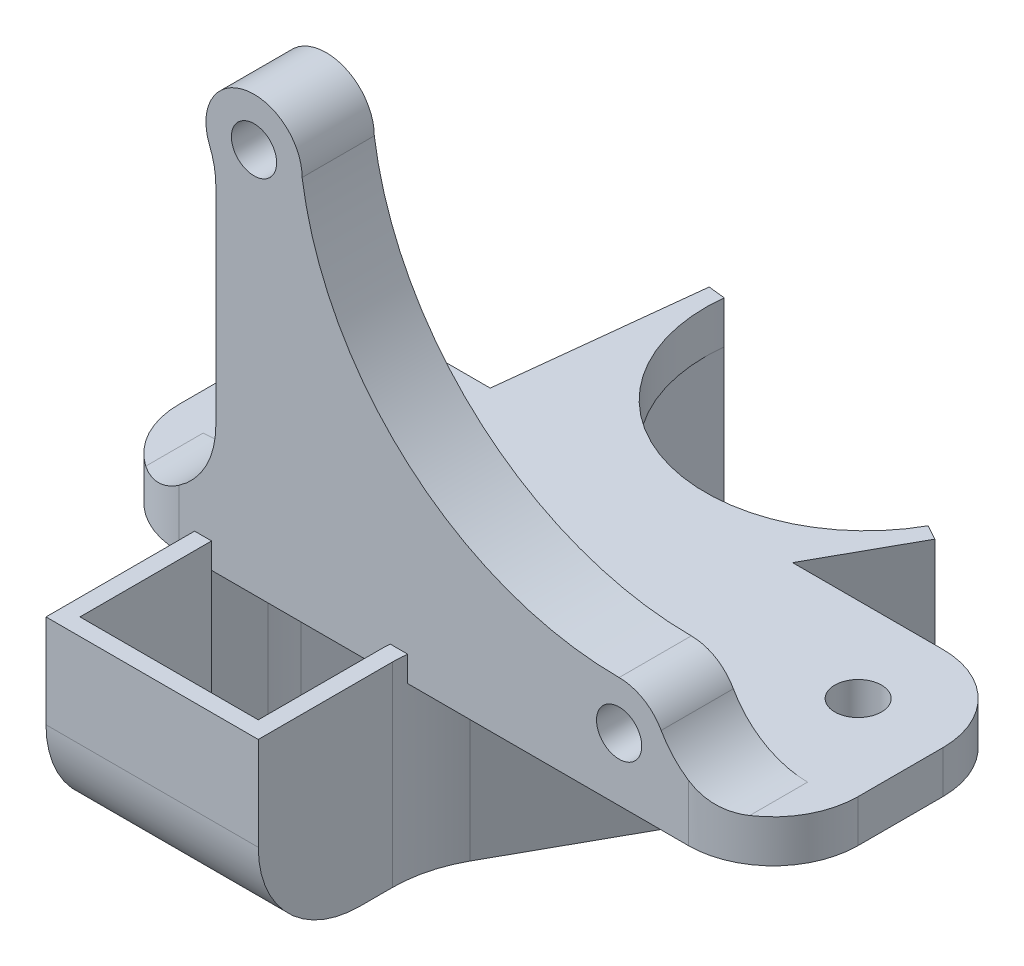
from build123d import *

# Parameters (mm, degrees)
SKETCH1_W           = 80
SKETCH1_H           = 30
SKETCH1_R           = 2.75
BOSS_EXTRUDE1_DEPTH = 5
SKETCH2_W           = 51.3
SKETCH2_H           = 8.5
BOSS_EXTRUDE2_DEPTH = 50
SKETCH3_R           = 2.665
CUT_EXTRUDE1_DEPTH  = 8
CUT_EXTRUDE2_REACH  = 76.33
BOSS_EXTRUDE3_DEPTH = 8.5
FILLET1_START       = 6.5
FILLET1_DEPTH       = 8.5
FILLET2_R           = 10
BOSS_EXTRUDE5_DEPTH = 5
BOSS_EXTRUDE6_DEPTH = 20
BOSS_EXTRUDE7_DEPTH = 20
CUT_EXTRUDE3_DEPTH  = 20
BOSS_EXTRUDE8_DEPTH = 3
FILLET4_START       = -20
FILLET4_DEPTH       = 20
FILLET4_2_DEPTH     = 4
FILLET4_3_DEPTH     = 23
BOSS_EXTRUDE9_DEPTH = 2
FILLET5_R           = 12


with BuildPart() as part:
    # Sketch1 → Boss-Extrude1 (new body)
    with BuildSketch(Plane(origin=(0, 0, 0), x_dir=(1, 0, 0), z_dir=(0, 1, 0))):
        Rectangle(SKETCH1_W, SKETCH1_H)
        with Locations(Location((30, 5, 0), (0, 0, 270))):
            Circle(SKETCH1_R, mode=Mode.SUBTRACT)
        with Locations(Location((-30, 5, 0), (0, 0, 270))):
            Circle(SKETCH1_R, mode=Mode.SUBTRACT)
    extrude(amount=BOSS_EXTRUDE1_DEPTH)

    # Sketch2 → Boss-Extrude2 (add)
    with BuildSketch(Plane(origin=(0, 5, 0), x_dir=(1, 0, 0), z_dir=(0, 1, 0))):
        with Locations((0, -10.75)):
            Rectangle(SKETCH2_W, SKETCH2_H)
    extrude(amount=BOSS_EXTRUDE2_DEPTH)

    # Sketch3 → Cut-Extrude1 (cut)
    with BuildSketch(Plane.XY.offset(15)):
        with Locations((21.85, 7.4)):
            Circle(SKETCH3_R)
        with Locations((-21.15, 45.4)):
            Circle(SKETCH3_R)
    extrude(amount=-CUT_EXTRUDE1_DEPTH, mode=Mode.SUBTRACT)

    # Sketch5 → Cut-Extrude2 (cut, up to next)
    with BuildSketch(Plane.XY.offset(15), mode=Mode.PRIVATE) as cut_extrude2_sk1:
        with BuildLine():
            ThreePointArc((-15.485, 45.4), (-2.845416832, 22.272479127), (21.85, 13.065))
            ThreePointArc((21.85, 13.065), (23.886047867, 12.68646707), (25.65, 11.601455105))
            Line((25.65, 11.601455105), (25.65, 55))
            Line((25.65, 55), (-25.65, 55))
            Line((-25.65, 55), (-25.65, 48.841253405))
            ThreePointArc((-25.65, 48.841253405), (-19.333447634, 50.765851517), (-15.485, 45.4))
        make_face()
    cut_extrude2_tool1 = extrude(cut_extrude2_sk1.sketch, amount=-CUT_EXTRUDE2_REACH, mode=Mode.PRIVATE) & part.part
    add(cut_extrude2_tool1.solids().sort_by_distance((6.645392, 37.171167, 15))[0], mode=Mode.SUBTRACT)

    # Sketch5<3> → Boss-Extrude3 (add)
    with BuildSketch(Plane.XY.offset(15)):
        with BuildLine():
            Line((25.65, 5), (26.981493447, 5))
            ThreePointArc((26.981493447, 5), (27.380015162, 6.170708615), (27.515, 7.4))
            ThreePointArc((27.515, 7.4), (27.027799967, 9.698393461), (25.65, 11.601455105))
            Line((25.65, 11.601455105), (25.65, 5))
        make_face()
        with BuildLine():
            ThreePointArc((-25.65, 48.841253405), (-26.815, 45.4), (-25.65, 41.958746595))
            Line((-25.65, 41.958746595), (-25.65, 48.841253405))
        make_face()
    extrude(amount=-BOSS_EXTRUDE3_DEPTH)

    # Fillet1: read off the stored shape, not the designer's step
    # Fillet1 outline → Fillet1 (add)
    with BuildSketch(Plane.XY.offset(FILLET1_START)):
        with BuildLine():
            ThreePointArc((-26.393696138, 43.256200613), (-25.837685324, 41.400248446), (-25.65, 39.471912197))
            Line((-25.65, 39.471912197), (-25.65, 41.958746595))
            ThreePointArc((-25.65, 41.958746595), (-26.064849981, 42.582825057), (-26.393696138, 43.256200613))
        make_face()
        with BuildLine():
            Line((-35.65, 5), (-25.65, 5))
            Line((-25.65, 5), (-25.65, 15))
            ThreePointArc((-25.65, 15), (-28.578932188, 7.928932188), (-35.65, 5))
        make_face()
        with BuildLine():
            ThreePointArc((35.547891261, 5), (30.474223926, 6.382697651), (26.803626173, 10.148420045))
            ThreePointArc((26.803626173, 10.148420045), (27.511622265, 7.595597351), (26.981493447, 5))
            Line((26.981493447, 5), (35.547891261, 5))
        make_face()
    extrude(amount=FILLET1_DEPTH)

    # Fillet2
    fillet2_edges = [part.edges().sort_by_distance(p)[0] for p in [
        (40, 2.5, 15),
        (40, 2.5, -15),
        (-40, 2.5, -15),
        (-40, 2.5, 15),
    ]]
    fillet(fillet2_edges, radius=FILLET2_R)

    # Sketch7 → Boss-Extrude5 (add)
    with BuildSketch(Plane.XZ):
        with BuildLine():
            Line((16.505683811, -26.744235317), (9.991112457, -15))
            Line((9.991112457, -15), (-21.314804171, -15))
            Line((-21.314804171, -15), (-18.759427627, -37.985545514))
            ThreePointArc((-18.759427627, -37.985545514), (-5.732504168, -17.916562593), (16.505683811, -26.744235317))
        make_face()
        Polygon((-18.759427627, -37.985545514), (-21.314804171, -15), (-23.327125696, -15), (-20.747181548, -38.206530469), align=None)
        Polygon((12.278203403, -15), (9.991112457, -15), (16.505683811, -26.744235317), (18.25463044, -25.774088066), align=None)
    extrude(amount=-BOSS_EXTRUDE5_DEPTH)

    # Sketch7<6> → Boss-Extrude6 (add)
    with BuildSketch(Plane.XZ):
        Polygon((-4.362909054, 15), (-6.65, 15), (9.991112457, -15), (12.278203403, -15), align=None)
        Polygon((12.278203403, -15), (9.991112457, -15), (16.505683811, -26.744235317), (18.25463044, -25.774088066), align=None)
        Polygon((-21.314804171, -15), (-24.650000035, 15), (-26.662321559, 15), (-26.637753956, 14.779015045), (-23.327125696, -15), align=None)
        Polygon((-18.759427627, -37.985545514), (-21.314804171, -15), (-23.327125696, -15), (-20.747181548, -38.206530469), align=None)
    extrude(amount=BOSS_EXTRUDE6_DEPTH)

    # Sketch8 → Boss-Extrude7 (add)
    with BuildSketch(Plane.XZ):
        Polygon((-5.15, 30.5), (-5.15, 22), (-5.15, 15), (-4.362909054, 15), (-3.15, 15), (-3.15, 22), (-3.15, 32.5), (-28.15, 32.5), (-28.15, 22), (-28.15, 15), (-25.9441307, 8.539891907), (-26.662321559, 15), (-26.15, 15), (-26.15, 22), (-26.15, 30.5), align=None)
        Polygon((-3.15, 15), (-4.362909054, 15), (-3.15, 12.813411109), align=None)
    extrude(amount=BOSS_EXTRUDE7_DEPTH)

    # Sketch8<3> → Cut-Extrude3 (cut)
    with BuildSketch(Plane.XZ):
        Polygon((-23.925860843, 8.48638681), (-24.650000035, 15), (-26.15, 15), align=None)
        Polygon((-6.65, 15), (-5.15, 15), (-5.15, 12.295853861), align=None)
    extrude(amount=CUT_EXTRUDE3_DEPTH, mode=Mode.SUBTRACT)

    # Sketch9 → Boss-Extrude8 (add)
    with BuildSketch(Plane(origin=(0, 0, 0), x_dir=(1, 0, 0), z_dir=(0, 1, 0))):
        Polygon((-3.15, -32.5), (-3.15, -15), (-5.15, -15), (-5.15, -30.5), (-26.15, -30.5), (-26.15, -15), (-28.15, -15), (-28.15, -32.5), align=None)
    extrude(amount=BOSS_EXTRUDE8_DEPTH)

    # Fillet4: read off the stored shape, not the designer's step
    # Fillet4 outline → Fillet4 (cut)
    with BuildSketch(Plane(origin=(0, 0, 0), x_dir=(1, 0, 0), z_dir=(0, 1, 0)).offset(FILLET4_START)):
        with BuildLine():
            ThreePointArc((-5.15, -16.177533225), (-4.671647561, -12.419641247), (-3.267099718, -8.901428842))
            Line((-3.267099718, -8.901428842), (-5.15, -12.295853861))
            Line((-5.15, -12.295853861), (-5.15, -16.177533225))
        make_face()
        with BuildLine():
            ThreePointArc((-28.15, -17.490360897), (-27.947447955, -15.033628513), (-27.345262132, -12.643244951))
            Line((-27.345262132, -12.643244951), (-28.15, -15))
            Line((-28.15, -15), (-28.15, -17.490360897))
        make_face()
        with BuildLine():
            ThreePointArc((-23.744211533, -6.852455992), (-24.013520151, -8.466795288), (-24.457103806, -10.042184774))
            Line((-24.457103806, -10.042184774), (-23.925860843, -8.48638681))
            Line((-23.925860843, -8.48638681), (-23.744211533, -6.852455992))
        make_face()
    extrude(amount=FILLET4_DEPTH, mode=Mode.SUBTRACT)

    # Fillet4 2 outline → Fillet4 2 (cut)
    with BuildSketch(Plane(origin=(0, 0, 0), x_dir=(1, 0, 0), z_dir=(0, 1, 0))):
        with BuildLine():
            Line((-5.15, -15), (-5.15, -16.177533225))
            ThreePointArc((-5.15, -16.177533225), (-5.138422804, -15.588311844), (-5.103709089, -15))
            Line((-5.103709089, -15), (-5.15, -15))
        make_face()
    extrude(amount=FILLET4_2_DEPTH, mode=Mode.SUBTRACT)

    # Fillet4 3 outline → Fillet4 3 (add)
    with BuildSketch(Plane(origin=(0, 0, 0), x_dir=(1, 0, 0), z_dir=(0, 1, 0)).offset(FILLET4_START)):
        with BuildLine():
            ThreePointArc((-25.76248139, -6.905961089), (-26.031790008, -8.520300385), (-26.475373663, -10.095689871))
            Line((-26.475373663, -10.095689871), (-25.9441307, -8.539891907))
            Line((-25.9441307, -8.539891907), (-25.76248139, -6.905961089))
        make_face()
        with BuildLine():
            Line((-3.15, -12.813411109), (-3.15, -16.695090474))
            ThreePointArc((-3.15, -16.695090474), (-2.671647561, -12.937198496), (-1.267099718, -9.41898609))
            Line((-1.267099718, -9.41898609), (-3.15, -12.813411109))
        make_face()
    extrude(amount=FILLET4_3_DEPTH)

    # Sketch10 → Boss-Extrude9 (add)
    with BuildSketch(Plane.XZ.offset(20)):
        with BuildLine():
            ThreePointArc((16.505683811, -26.744235317), (-5.732504168, -17.916562593), (-18.759427627, -37.985545514))
            Line((-18.759427627, -37.985545514), (-23.744211533, 6.852455992))
            ThreePointArc((-23.744211533, 6.852455992), (-24.013520151, 8.466795288), (-24.457103806, 10.042184774))
            Line((-24.457103806, 10.042184774), (-26.15, 15))
            Line((-26.15, 15), (-26.15, 30.5))
            Line((-26.15, 30.5), (-5.15, 30.5))
            Line((-5.15, 30.5), (-5.15, 16.177533225))
            ThreePointArc((-5.15, 16.177533225), (-4.671647561, 12.419641247), (-3.267099718, 8.901428842))
            Line((-3.267099718, 8.901428842), (16.505683811, -26.744235317))
        make_face()
        with BuildLine():
            Line((-26.15, 30.5), (-5.15, 30.5))
            Line((-5.15, 30.5), (-5.15, 16.177533225))
            ThreePointArc((-5.15, 16.177533225), (-4.671647561, 12.419641247), (-3.267099718, 8.901428842))
            Line((-3.267099718, 8.901428842), (16.505683811, -26.744235317))
            Line((16.505683811, -26.744235317), (18.25463044, -25.774088066))
            Line((18.25463044, -25.774088066), (-1.267099718, 9.41898609))
            ThreePointArc((-1.267099718, 9.41898609), (-2.671647561, 12.937198496), (-3.15, 16.695090474))
            Line((-3.15, 16.695090474), (-3.15, 32.5))
            Line((-3.15, 32.5), (-28.15, 32.5))
            Line((-28.15, 32.5), (-28.15, 17.490360897))
            ThreePointArc((-28.15, 17.490360897), (-27.947447955, 15.033628513), (-27.345262132, 12.643244951))
            Line((-27.345262132, 12.643244951), (-26.475373663, 10.095689871))
            ThreePointArc((-26.475373663, 10.095689871), (-26.031790008, 8.520300385), (-25.76248139, 6.905961089))
            Line((-25.76248139, 6.905961089), (-20.747181548, -38.206530469))
            Line((-20.747181548, -38.206530469), (-18.759427627, -37.985545514))
            Line((-18.759427627, -37.985545514), (-23.744211533, 6.852455992))
            ThreePointArc((-23.744211533, 6.852455992), (-24.013520151, 8.466795288), (-24.457103806, 10.042184774))
            Line((-24.457103806, 10.042184774), (-26.15, 15))
            Line((-26.15, 15), (-26.15, 30.5))
        make_face()
    extrude(amount=-BOSS_EXTRUDE9_DEPTH)

    # Fillet5
    fillet5_edges = [part.edges().sort_by_distance(p)[0] for p in [
        (-15.65, -20, 32.5),
        (-15.65, -18, 30.5),
    ]]
    fillet(fillet5_edges, radius=FILLET5_R)


solid = part.part
